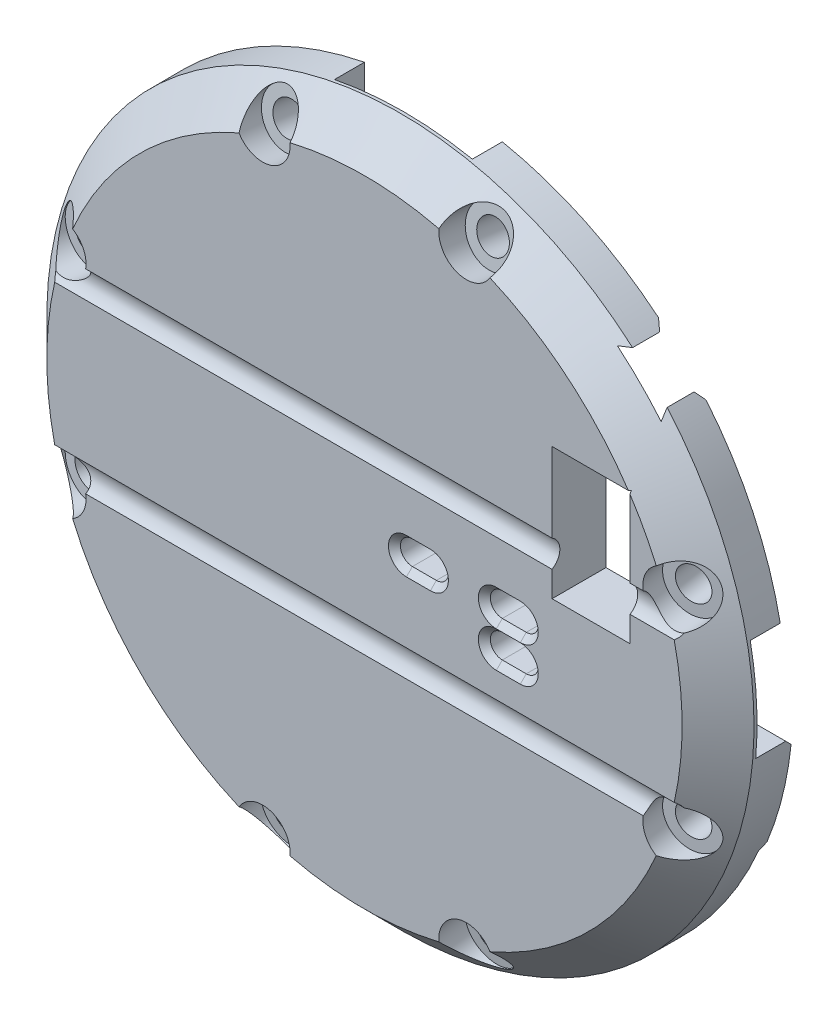
from build123d import *

# Parameters (mm, degrees)
SKETCH1_R               = 29.5
BOSS_EXTRUDE1_DEPTH     = 5.75
SKETCH3_W               = 44.5
SKETCH3_H               = 44.5
CUT_EXTRUDE1_DEPTH      = 3.25
BOSS_EXTRUDE5_DEPTH     = 3.25
CHAMFER2_SIZE           = 3
CUT_EXTRUDE5_DEPTH      = 43.113685424
CUT_EXTRUDE5_DEPTH_BACK = 43.113685424
SKETCH9_R               = 1.3
SKETCH10_W              = 12.03351403
SKETCH10_H              = 11.5
SKETCH10_W_2            = 11.5
SKETCH10_H_2            = 12.03351403
CUT_EXTRUDE6_DEPTH      = 2.5
SKETCH13_W              = 6.5
SKETCH13_H              = 11
CUT_EXTRUDE9_DEPTH      = 42.845698845
SKETCH14_W              = 15.887507813
SKETCH14_H              = 11.6
CUT_EXTRUDE10_DEPTH     = 2.5
BOSS_EXTRUDE3_START     = 3
BOSS_EXTRUDE3_DEPTH     = 3
SKETCH17_R              = 1.35
CUT_EXTRUDE12_DEPTH     = 43.113685578
CUT_EXTRUDE13_START     = 20
SKETCH18_R              = 2.3
CUT_EXTRUDE13_DEPTH     = 13
CIRPATTERN1_COUNT       = 4
CUT_EXTRUDE14_DEPTH     = 43.184861168
BOSS_EXTRUDE2_DEPTH     = 2
FILLET1_R               = 1
BOSS_EXTRUDE4_DEPTH     = 2
CHAMFER3_SIZE           = 0.5
CHAMFER4_SIZE           = 0.5
CHAMFER5_SIZE           = 0.5


# Some blends are built 0.0001 mm under size
with BuildPart() as part:
    # Sketch1 → Boss-Extrude1 (new body)
    with BuildSketch(Plane.XY):
        Circle(SKETCH1_R)
    extrude(amount=BOSS_EXTRUDE1_DEPTH)

    # Sketch3 → Cut-Extrude1 (cut)
    with BuildSketch(Plane(origin=(0, 0, 0), x_dir=(-1, 0, 0), z_dir=(0, 0, -1))):
        Rectangle(SKETCH3_W, SKETCH3_H)
    extrude(amount=-CUT_EXTRUDE1_DEPTH, mode=Mode.SUBTRACT)

    # Sketch26 → Boss-Extrude5 (add)
    with BuildSketch(Plane(origin=(0, 0, 0), x_dir=(-1, 0, 0), z_dir=(0, 0, -1))):
        with BuildLine():
            Line((22.25, 19.369757355), (22.25, 17.809758561))
            ThreePointArc((22.25, 17.809758561), (20.152543264, 20.152543264), (17.809758561, 22.25))
            Line((17.809758561, 22.25), (19.369757355, 22.25))
            ThreePointArc((19.369757355, 22.25), (20.859650045, 20.859650045), (22.25, 19.369757355))
        make_face()
        with BuildLine():
            Line((19.369757355, -22.25), (17.809758561, -22.25))
            ThreePointArc((17.809758561, -22.25), (20.152543264, -20.152543264), (22.25, -17.809758561))
            Line((22.25, -17.809758561), (22.25, -19.369757355))
            ThreePointArc((22.25, -19.369757355), (20.859650045, -20.859650045), (19.369757355, -22.25))
        make_face()
        with BuildLine():
            Line((-22.25, -19.369757355), (-22.25, -17.809758561))
            ThreePointArc((-22.25, -17.809758561), (-20.152543264, -20.152543264), (-17.809758561, -22.25))
            Line((-17.809758561, -22.25), (-19.369757355, -22.25))
            ThreePointArc((-19.369757355, -22.25), (-20.859650045, -20.859650045), (-22.25, -19.369757355))
        make_face()
    extrude(amount=-BOSS_EXTRUDE5_DEPTH)

    # Chamfer2
    # the kernel refuses this chamfer: 3 mm, written as the material it takes off along each edge
    with BuildSketch(Plane(origin=(0, 0, 5.75), x_dir=(1, 0, 0), z_dir=(0, -1, 0))) as chamfer2_piece_1:
        Polygon((29.5, -CHAMFER2_SIZE), (29.5 - CHAMFER2_SIZE, 0), (29.5, 0), align=None)
    revolve(axis=Axis((0, 0, 5.75), (0, 0, 1)), mode=Mode.SUBTRACT)

    # Sketch9 → Cut-Extrude5 (cut, two sides: drawn at the far end of the back side and taken through both)
    with BuildSketch(Plane(origin=(0, 0, 0), x_dir=(0, 0, -1), z_dir=(1, 0, 0)).offset(-CUT_EXTRUDE5_DEPTH_BACK)):
        with Locations((-6.4, 7)):
            Circle(SKETCH9_R)
        with Locations((-6.4, -7)):
            Circle(SKETCH9_R)
    extrude(amount=CUT_EXTRUDE5_DEPTH + CUT_EXTRUDE5_DEPTH_BACK, mode=Mode.SUBTRACT)

    # Sketch10 → Cut-Extrude6 (cut)
    with BuildSketch(Plane(origin=(0, 0, 0), x_dir=(-1, 0, 0), z_dir=(0, 0, -1))):
        with Locations((28.01742408, 0)):
            Rectangle(SKETCH10_W, SKETCH10_H)
        with Locations((-28.01742408, 0)):
            Rectangle(SKETCH10_W, SKETCH10_H)
        with Locations((0, 28.01742408)):
            Rectangle(SKETCH10_W_2, SKETCH10_H_2)
    extrude(amount=-CUT_EXTRUDE6_DEPTH, mode=Mode.SUBTRACT)

    # Sketch13 → Cut-Extrude9 (cut, through all)
    with BuildSketch(Plane(origin=(0, 0, 3.25), x_dir=(-1, 0, 0), z_dir=(0, 0, -1))):
        with Locations((-18.9, 9.25)):
            Rectangle(SKETCH13_W, SKETCH13_H)
    extrude(amount=-CUT_EXTRUDE9_DEPTH, mode=Mode.SUBTRACT)

    # Sketch14 → Cut-Extrude10 (cut)
    with BuildSketch(Plane(origin=(0, 0, 0), x_dir=(-1, 0, 0), z_dir=(0, 0, -1))):
        with Locations((-27.176000206, -5.8)):
            Rectangle(SKETCH14_W, SKETCH14_H)
    extrude(amount=-CUT_EXTRUDE10_DEPTH, mode=Mode.SUBTRACT)

    # Sketch23 → Boss-Extrude3 (add)
    with BuildSketch(Plane(origin=(0, 0, 2.5), x_dir=(-1, 0, 0), z_dir=(0, 0, -1)).offset(BOSS_EXTRUDE3_START)):
        with BuildLine():
            Line((-22.25, -2.55), (-29.389581487, -2.55))
            ThreePointArc((-29.389581487, -2.55), (-28.616616042, -7.165143842), (-27.123605955, -11.6))
            Line((-27.123605955, -11.6), (-22.25, -11.6))
            Line((-22.25, -11.6), (-22.25, -2.55))
        make_face()
    extrude(amount=-BOSS_EXTRUDE3_DEPTH)

    # Sketch17 → Cut-Extrude12 (cut, through all)
    with BuildSketch(Plane(origin=(0, 0, 0), x_dir=(0, -1, 0), z_dir=(0.13917310096006574, 0, 0.9902680687415703))):
        with Locations(Location((-8.5, 24.5, 0), (0, 0, 270))):
            Circle(SKETCH17_R)
        with Locations(Location((8.5, 24.5, 0), (0, 0, 270))):
            Circle(SKETCH17_R)
    cut_extrude12 = extrude(amount=CUT_EXTRUDE12_DEPTH, mode=Mode.SUBTRACT)

    # Sketch18 → Cut-Extrude13 (cut)
    with BuildSketch(Plane(origin=(0, 0, 0), x_dir=(0, -1, 0), z_dir=(0.13917310096006574, 0, 0.9902680687415703)).offset(CUT_EXTRUDE13_START)):
        with Locations(Location((-8.5, 24.5, 0), (0, 0, 90))):
            Circle(SKETCH18_R)
        with Locations(Location((8.5, 24.5, 0), (0, 0, 90))):
            Circle(SKETCH18_R)
    cut_extrude13 = extrude(amount=-CUT_EXTRUDE13_DEPTH, mode=Mode.SUBTRACT)

    # CirPattern1: Cut-Extrude12, Cut-Extrude13 ×4 about axis
    cirpattern1_axis = Axis((0, 0, 0), (0, 0, 1))
    add([cut_extrude12.rotate(cirpattern1_axis, i * 360 / CIRPATTERN1_COUNT) for i in range(1, CIRPATTERN1_COUNT)], mode=Mode.SUBTRACT)
    add([cut_extrude13.rotate(cirpattern1_axis, i * 360 / CIRPATTERN1_COUNT) for i in range(1, CIRPATTERN1_COUNT)], mode=Mode.SUBTRACT)

    # Sketch19 → Cut-Extrude14 (cut, through all)
    with BuildSketch(Plane.XY.offset(5.75)):
        with BuildLine():
            Line((3.5, 1.75), (5.5, 1.75))
            ThreePointArc((5.5, 1.75), (6.5, 0.75), (5.5, -0.25))
            Line((5.5, -0.25), (3.5, -0.25))
            ThreePointArc((3.5, -0.25), (2.5, 0.75), (3.5, 1.75))
        make_face()
        with BuildLine():
            Line((11, 1.75), (13, 1.75))
            ThreePointArc((13, 1.75), (14, 0.75), (13, -0.25))
            Line((13, -0.25), (11, -0.25))
            ThreePointArc((11, -0.25), (10, 0.75), (11, 1.75))
        make_face()
        with BuildLine():
            Line((11, -1.25), (13, -1.25))
            ThreePointArc((13, -1.25), (14, -2.25), (13, -3.25))
            Line((13, -3.25), (11, -3.25))
            ThreePointArc((11, -3.25), (10, -2.25), (11, -1.25))
        make_face()
    extrude(amount=-CUT_EXTRUDE14_DEPTH, mode=Mode.SUBTRACT)

    # Sketch21 → Boss-Extrude2 (add)
    # profile 1 of 2: a face of its own
    with BuildSketch(Plane(origin=(0, 0, 3.25), x_dir=(-1, 0, 0), z_dir=(0, 0, -1))):
        with BuildLine():
            Line((-5.5, -1.35), (-3.5, -1.35))
            ThreePointArc((-3.5, -1.35), (-1.4, 0.75), (-3.5, 2.85))
            Line((-3.5, 2.85), (-5.5, 2.85))
            ThreePointArc((-5.5, 2.85), (-7.6, 0.75), (-5.5, -1.35))
        make_face()
        with BuildLine():
            Line((-5.5, -0.35), (-3.5, -0.35))
            ThreePointArc((-3.5, -0.35), (-2.4, 0.75), (-3.5, 1.85))
            Line((-3.5, 1.85), (-5.5, 1.85))
            ThreePointArc((-5.5, 1.85), (-6.6, 0.75), (-5.5, -0.35))
        make_face(mode=Mode.SUBTRACT)
    # profile 2 of 2: a face of its own
    with BuildSketch(Plane(origin=(0, 0, 3.25), x_dir=(-1, 0, 0), z_dir=(0, 0, -1))):
        with BuildLine():
            Line((-11, 2.85), (-13, 2.85))
            ThreePointArc((-13, 2.85), (-14.94422221, 1.543725393), (-14.469693846, -0.75))
            ThreePointArc((-14.469693846, -0.75), (-14.94422221, -3.043725393), (-13, -4.35))
            Line((-13, -4.35), (-11, -4.35))
            ThreePointArc((-11, -4.35), (-9.05577779, -3.043725393), (-9.530306154, -0.75))
            ThreePointArc((-9.530306154, -0.75), (-9.05577779, 1.543725393), (-11, 2.85))
        make_face()
        with BuildLine():
            Line((-11, 1.85), (-13, 1.85))
            ThreePointArc((-13, 1.85), (-14.1, 0.75), (-13, -0.35))
            Line((-13, -0.35), (-11, -0.35))
            ThreePointArc((-11, -0.35), (-9.9, 0.75), (-11, 1.85))
        make_face(mode=Mode.SUBTRACT)
        with BuildLine():
            Line((-11, -1.15), (-13, -1.15))
            ThreePointArc((-13, -1.15), (-14.1, -2.25), (-13, -3.35))
            Line((-13, -3.35), (-11, -3.35))
            ThreePointArc((-11, -3.35), (-9.9, -2.25), (-11, -1.15))
        make_face(mode=Mode.SUBTRACT)
    extrude(amount=BOSS_EXTRUDE2_DEPTH)

    # Fillet1
    fillet1_edges = [part.edges().sort_by_distance(p)[0] for p in [
        (7.6, 0.75, 3.25),
        (4.5, -1.35, 3.25),
        (1.4, 0.75, 3.25),
        (4.5, 2.85, 3.25),
        (14.94422221, -3.043725393, 3.25),
        (12, -4.35, 3.25),
        (9.05577779, -3.043725393, 3.25),
    ]]
    fillet(fillet1_edges, radius=FILLET1_R)

    # Sketch25 → Boss-Extrude4 (add)
    with BuildSketch(Plane(origin=(0, 0, 3.25), x_dir=(-1, 0, 0), z_dir=(0, 0, -1))):
        Polygon((-22.25, 15.75), (-22.25, 14.75), (-15.65, 14.75), (-15.65, 3.75), (-22.25, 3.75), (-22.25, 2.75), (-14.65, 2.75), (-14.65, 15.75), align=None)
    extrude(amount=BOSS_EXTRUDE4_DEPTH)

    # Chamfer3
    chamfer3_edges = [part.edges().sort_by_distance(p)[0] for p in [
        (18.45, 15.75, 1.25),
        (18.45, 2.75, 1.25),
        (14.65, 9.25, 1.25),
    ]]
    chamfer(chamfer3_edges, length=CHAMFER3_SIZE)

    # Chamfer4
    chamfer4_edges = [part.edges().sort_by_distance(p)[0] for p in [
        (2.5, 0.75, 5.75),
        (4.5, -0.25, 5.75),
        (6.5, 0.75, 5.75),
        (4.5, 1.75, 5.75),
        (10, 0.75, 5.75),
        (12, -0.25, 5.75),
        (14, 0.75, 5.75),
        (12, 1.75, 5.75),
        (10, -2.25, 5.75),
        (12, -3.25, 5.75),
        (14, -2.25, 5.75),
        (12, -1.25, 5.75),
    ]]
    chamfer(chamfer4_edges, length=CHAMFER4_SIZE - 0.0001)  # a hair under: the kernel refuses the full size

    # Chamfer5
    chamfer5_edges = [part.edges().sort_by_distance(p)[0] for p in [
        (-22.25, 11.77987928, 0),
        (-22.25, -11.77987928, 0),
        (0, -22.25, 0),
        (22.25, -7.075, -0.5),
        (22.25, 12.559878678, 0),
        (-11.77987928, 22.25, 0),
        (12.559878678, 22.25, 0),
        (24.686802977, -11.6, -0.5),
        (25.819790744, -2.55, -0.5),
    ]]
    chamfer(chamfer5_edges, length=CHAMFER5_SIZE - 0.0001)  # a hair under: the kernel refuses the full size


solid = part.part
